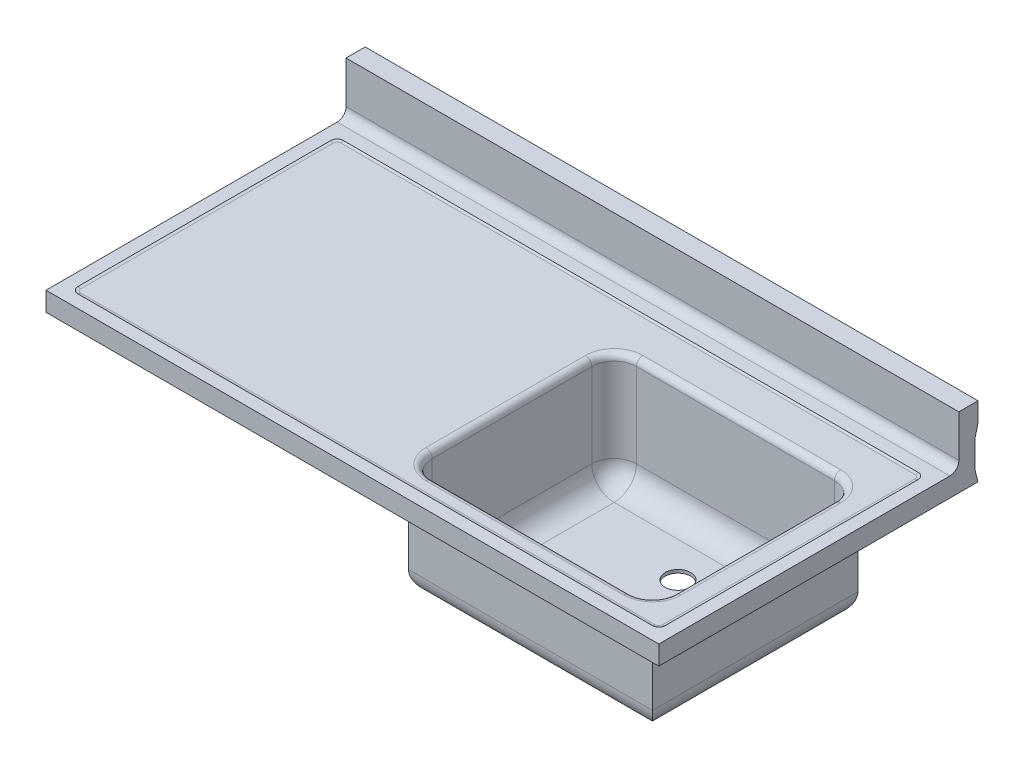
from build123d import *

# Parameters (mm, degrees)
SKETCH1_W           = 1219.2
SKETCH1_H           = 635
BOSS_EXTRUDE2_DEPTH = 330.2
SKETCH3_W           = 1219.2
SKETCH3_H           = 101.6
CUT_EXTRUDE1_DEPTH  = 596.9
FILLET2_R           = 17.78
CUT_EXTRUDE2_DEPTH  = 226.06
FILLET4_R           = 44.45
CUT_EXTRUDE3_DEPTH  = 1.27
FILLET5_R           = 12.7
CUT_EXTRUDE4_DEPTH  = 608.33
CUT_EXTRUDE6_DEPTH  = 316.23
SKETCH12_W          = 635
SKETCH12_H          = 190.5
CUT_EXTRUDE7_DEPTH  = 2.54
SKETCH13_W          = 635
SKETCH13_H          = 190.5
CUT_EXTRUDE8_DEPTH  = 2.54
SKETCH15_R          = 25.4
CUT_EXTRUDE9_DEPTH  = 6.35
CUT_EXTRUDE10_START = -1219.2
CUT_EXTRUDE10_DEPTH = 1219.2


with BuildPart() as part:
    # Sketch1 → Boss-Extrude2 (new body)
    with BuildSketch(Plane(origin=(0, 0, 0), x_dir=(1, 0, 0), z_dir=(0, 1, 0))):
        Rectangle(SKETCH1_W, SKETCH1_H)
    extrude(amount=BOSS_EXTRUDE2_DEPTH)

    # Sketch3 → Cut-Extrude1 (cut)
    with BuildSketch(Plane.XY.offset(317.5)):
        with Locations((0, 279.4)):
            Rectangle(SKETCH3_W, SKETCH3_H)
    extrude(amount=-CUT_EXTRUDE1_DEPTH, mode=Mode.SUBTRACT)

    # Fillet2
    fillet2_edges = [part.edges().sort_by_distance(p)[0] for p in [
        (0, 228.6, -279.4),
    ]]
    fillet(fillet2_edges, radius=FILLET2_R)

    # Sketch5 → Cut-Extrude2 (cut)
    with BuildSketch(Plane(origin=(0, 228.6, 0), x_dir=(1, 0, 0), z_dir=(0, 1, 0))):
        with BuildLine():
            Line((95.25, 152.4), (488.95, 152.4))
            ThreePointArc((488.95, 152.4), (520.380896424, 139.380896424), (533.4, 107.95))
            Line((533.4, 107.95), (533.4, -209.55))
            ThreePointArc((533.4, -209.55), (520.380896424, -240.980896424), (488.95, -254))
            Line((488.95, -254), (95.25, -254))
            ThreePointArc((95.25, -254), (63.819103576, -240.980896424), (50.8, -209.55))
            Line((50.8, -209.55), (50.8, 107.95))
            ThreePointArc((50.8, 107.95), (63.819103576, 139.380896424), (95.25, 152.4))
        make_face()
    extrude(amount=-CUT_EXTRUDE2_DEPTH, mode=Mode.SUBTRACT)

    # Fillet4
    fillet4_edges = [part.edges().sort_by_distance(p)[0] for p in [
        (520.380896424, 2.54, -139.380896424),
        (533.4, 2.54, 50.8),
        (520.380896424, 2.54, 240.980896424),
        (292.1, 2.54, 254),
        (63.819103576, 2.54, 240.980896424),
        (50.8, 2.54, 50.8),
        (63.819103576, 2.54, -139.380896424),
        (292.1, 2.54, -152.4),
    ]]
    fillet(fillet4_edges, radius=FILLET4_R)

    # Sketch7 → Cut-Extrude3 (cut)
    with BuildSketch(Plane(origin=(0, 228.6, 0), x_dir=(1, 0, 0), z_dir=(0, 1, 0))):
        with BuildLine():
            Line((-571.5, -292.1), (571.5, -292.1))
            ThreePointArc((571.5, -292.1), (580.480256121, -288.380256121), (584.2, -279.4))
            Line((584.2, -279.4), (584.2, 223.52))
            ThreePointArc((584.2, 223.52), (580.480256121, 232.500256121), (571.5, 236.22))
            Line((571.5, 236.22), (-571.5, 236.22))
            ThreePointArc((-571.5, 236.22), (-580.480256121, 232.500256121), (-584.2, 223.52))
            Line((-584.2, 223.52), (-584.2, -279.4))
            ThreePointArc((-584.2, -279.4), (-580.480256121, -288.380256121), (-571.5, -292.1))
        make_face()
    extrude(amount=-CUT_EXTRUDE3_DEPTH, mode=Mode.SUBTRACT)

    # Fillet5
    # the kernel refuses this fillet: 12.7 mm, written as the material it adds along each edge
    with BuildSketch(Plane(origin=(-571.5, 227.33, 292.1), x_dir=(0, 0, -1), z_dir=(1, 0, 0)), Plane(origin=(571.5, 227.33, -236.22), x_dir=(0, 0, 1), z_dir=(-1, 0, 0))) as fillet5_piece_1:
        with BuildLine():
            CenterArc((5.535801658, 12.7), FILLET5_R, 244.158067237, 25.841932763)
            Line((0, 1.27), (0, 0))
            Line((0, 0), (5.535801658, 0))
        make_face()
    extrude(amount=1143)
    with BuildSketch(Plane(origin=(-571.5, 227.33, 279.4), x_dir=(-1, 0, 0), z_dir=(0, 0, -1))) as fillet5_piece_2:
        with BuildLine():
            CenterArc((7.164198342, 12.7), FILLET5_R, 270, 25.841932763)
            Line((12.7, 1.27), (12.7, 0))
            Line((12.7, 0), (7.164198342, 0))
        make_face()
    revolve(axis=Axis((-571.5, 227.33, 279.4), (0, 1, 0)), revolution_arc=90)
    with BuildSketch(Plane(origin=(-584.2, 227.33, -223.52), x_dir=(1, 0, 0), z_dir=(0, 0, 1)), Plane(origin=(584.2, 227.33, 279.4), x_dir=(-1, 0, 0), z_dir=(0, 0, -1))) as fillet5_piece_3:
        with BuildLine():
            CenterArc((5.535801658, 12.7), FILLET5_R, 244.158067237, 25.841932763)
            Line((0, 1.27), (0, 0))
            Line((0, 0), (5.535801658, 0))
        make_face()
    extrude(amount=502.92)
    with BuildSketch(Plane(origin=(-571.5, 227.33, -223.52), x_dir=(0, 0, -1), z_dir=(1, 0, 0))) as fillet5_piece_4:
        with BuildLine():
            CenterArc((7.164198342, 12.7), FILLET5_R, 270, 25.841932763)
            Line((12.7, 1.27), (12.7, 0))
            Line((12.7, 0), (7.164198342, 0))
        make_face()
    revolve(axis=Axis((-571.5, 227.33, -223.52), (0, 1, 0)), revolution_arc=90)
    with BuildSketch(Plane(origin=(571.5, 227.33, -223.52), x_dir=(1, 0, 0), z_dir=(0, 0, 1))) as fillet5_piece_5:
        with BuildLine():
            CenterArc((7.164198342, 12.7), FILLET5_R, 270, 25.841932763)
            Line((12.7, 1.27), (12.7, 0))
            Line((12.7, 0), (7.164198342, 0))
        make_face()
    revolve(axis=Axis((571.5, 227.33, -223.52), (0, 1, 0)), revolution_arc=90)
    with BuildSketch(Plane(origin=(571.5, 227.33, 279.4), x_dir=(0, 0, 1), z_dir=(-1, 0, 0))) as fillet5_piece_6:
        with BuildLine():
            CenterArc((7.164198342, 12.7), FILLET5_R, 270, 25.841932763)
            Line((12.7, 1.27), (12.7, 0))
            Line((12.7, 0), (7.164198342, 0))
        make_face()
    revolve(axis=Axis((571.5, 227.33, 279.4), (0, 1, 0)), revolution_arc=90)
    # the kernel refuses this fillet: 12.7 mm, written as the material it takes off along each edge
    with BuildSketch(Plane(origin=(488.95, 227.33, -107.95), x_dir=(1, 0, 0), z_dir=(0, 0, 1))) as fillet5_2_piece_1:
        with BuildLine():
            CenterArc((44.45 + FILLET5_R, -FILLET5_R), FILLET5_R, 90, 90)
            Line((44.45, -FILLET5_R), (44.45, 0))
            Line((44.45, 0), (44.45 + FILLET5_R, 0))
        make_face()
    revolve(axis=Axis((488.95, 227.33, -107.95), (0, 1, 0)), revolution_arc=90, mode=Mode.SUBTRACT)
    with BuildSketch(Plane(origin=(488.95, 227.33, -152.4), x_dir=(0, 0, -1), z_dir=(-1, 0, 0)), Plane(origin=(95.25, 227.33, 254), x_dir=(0, 0, 1), z_dir=(1, 0, 0))) as fillet5_2_piece_2:
        with BuildLine():
            CenterArc((FILLET5_R, FILLET5_R), FILLET5_R, 180, 90)
            Line((0, FILLET5_R), (0, 0))
            Line((0, 0), (FILLET5_R, 0))
        make_face()
    extrude(amount=393.7, mode=Mode.SUBTRACT)
    with BuildSketch(Plane(origin=(95.25, 227.33, -107.95), x_dir=(0, 0, -1), z_dir=(1, 0, 0))) as fillet5_2_piece_3:
        with BuildLine():
            CenterArc((44.45 + FILLET5_R, -FILLET5_R), FILLET5_R, 90, 90)
            Line((44.45, -FILLET5_R), (44.45, 0))
            Line((44.45, 0), (44.45 + FILLET5_R, 0))
        make_face()
    revolve(axis=Axis((95.25, 227.33, -107.95), (0, 1, 0)), revolution_arc=90, mode=Mode.SUBTRACT)
    with BuildSketch(Plane(origin=(50.8, 227.33, -107.95), x_dir=(0, -1, 0), z_dir=(0, 0, 1))) as fillet5_2_piece_4:
        with BuildLine():
            CenterArc((FILLET5_R, -FILLET5_R), FILLET5_R, 90, 90)
            Line((0, -FILLET5_R), (0, 0))
            Line((0, 0), (FILLET5_R, 0))
        make_face()
    extrude(amount=317.5, mode=Mode.SUBTRACT)
    with BuildSketch(Plane(origin=(95.25, 227.33, 209.55), x_dir=(-1, 0, 0), z_dir=(0, 0, -1))) as fillet5_2_piece_5:
        with BuildLine():
            CenterArc((44.45 + FILLET5_R, -FILLET5_R), FILLET5_R, 90, 90)
            Line((44.45, -FILLET5_R), (44.45, 0))
            Line((44.45, 0), (44.45 + FILLET5_R, 0))
        make_face()
    revolve(axis=Axis((95.25, 227.33, 209.55), (0, 1, 0)), revolution_arc=90, mode=Mode.SUBTRACT)
    with BuildSketch(Plane(origin=(488.95, 227.33, 209.55), x_dir=(0, 0, 1), z_dir=(-1, 0, 0))) as fillet5_2_piece_6:
        with BuildLine():
            CenterArc((44.45 + FILLET5_R, -FILLET5_R), FILLET5_R, 90, 90)
            Line((44.45, -FILLET5_R), (44.45, 0))
            Line((44.45, 0), (44.45 + FILLET5_R, 0))
        make_face()
    revolve(axis=Axis((488.95, 227.33, 209.55), (0, 1, 0)), revolution_arc=90, mode=Mode.SUBTRACT)
    with BuildSketch(Plane(origin=(533.4, 227.33, 209.55), x_dir=(1, 0, 0), z_dir=(0, 0, -1))) as fillet5_2_piece_7:
        with BuildLine():
            CenterArc((FILLET5_R, FILLET5_R), FILLET5_R, 180, 90)
            Line((0, FILLET5_R), (0, 0))
            Line((0, 0), (FILLET5_R, 0))
        make_face()
    extrude(amount=317.5, mode=Mode.SUBTRACT)

    # Sketch9 → Cut-Extrude4 (cut, symmetric)
    with BuildSketch(Plane(origin=(0, 0, 0), x_dir=(0, 0, -1), z_dir=(1, 0, 0))):
        with BuildLine():
            Line((317.5, 226.06), (198.12, 226.06))
            ThreePointArc((198.12, 226.06), (166.689103576, 213.040896424), (153.67, 181.61))
            Line((153.67, 181.61), (153.67, 45.72))
            ThreePointArc((153.67, 45.72), (140.650896424, 14.289103576), (109.22, 1.27))
            Line((109.22, 1.27), (-210.82, 1.27))
            ThreePointArc((-210.82, 1.27), (-242.250896424, 14.289103576), (-255.27, 45.72))
            Line((-255.27, 45.72), (-255.27, 181.61))
            ThreePointArc((-255.27, 181.61), (-268.289103576, 213.040896424), (-299.72, 226.06))
            Line((-299.72, 226.06), (-316.23, 226.06))
            Line((-316.23, 226.06), (-316.23, 190.5))
            Line((-316.23, 190.5), (-317.5, 190.5))
            Line((-317.5, 190.5), (-317.5, 0))
            Line((-317.5, 0), (317.5, 0))
            Line((317.5, 0), (317.5, 226.06))
        make_face()
    extrude(amount=CUT_EXTRUDE4_DEPTH, both=True, mode=Mode.SUBTRACT)

    # Sketch11 → Cut-Extrude6 (cut, symmetric)
    with BuildSketch(Plane.XY):
        with BuildLine():
            Line((-608.33, 226.06), (5.08, 226.06))
            ThreePointArc((5.08, 226.06), (36.510896424, 213.040896424), (49.53, 181.61))
            Line((49.53, 181.61), (49.53, 45.72))
            ThreePointArc((49.53, 45.72), (62.549103576, 14.289103576), (93.98, 1.27))
            Line((93.98, 1.27), (-608.33, 1.27))
            Line((-608.33, 1.27), (-608.33, 226.06))
        make_face()
        with BuildLine():
            Line((534.67, 45.72), (534.67, 181.61))
            ThreePointArc((534.67, 181.61), (547.689103576, 213.040896424), (579.12, 226.06))
            Line((579.12, 226.06), (608.33, 226.06))
            Line((608.33, 226.06), (608.33, 1.27))
            Line((608.33, 1.27), (490.22, 1.27))
            ThreePointArc((490.22, 1.27), (521.650896424, 14.289103576), (534.67, 45.72))
        make_face()
    extrude(amount=CUT_EXTRUDE6_DEPTH, both=True, mode=Mode.SUBTRACT)

    # Sketch12 → Cut-Extrude7 (cut)
    with BuildSketch(Plane.ZY.offset(609.6)):
        with Locations((0, 95.25)):
            Rectangle(SKETCH12_W, SKETCH12_H)
    extrude(amount=-CUT_EXTRUDE7_DEPTH, mode=Mode.SUBTRACT)

    # Sketch13 → Cut-Extrude8 (cut)
    with BuildSketch(Plane(origin=(609.6, 0, 0), x_dir=(0, 0, -1), z_dir=(1, 0, 0))):
        with Locations((0, 95.25)):
            Rectangle(SKETCH13_W, SKETCH13_H)
    extrude(amount=-CUT_EXTRUDE8_DEPTH, mode=Mode.SUBTRACT)

    # Sketch16 → Revolve1 (revolve)
    with BuildSketch(Plane(origin=(292.1, 0, 0), x_dir=(0, 0, -1), z_dir=(1, 0, 0)), mode=Mode.PRIVATE) as revolve1_sk:
        with BuildLine():
            Line((38.1, 1.27), (38.1, -3.81))
            Line((38.1, -3.81), (77.47, -3.81))
            ThreePointArc((77.47, -3.81), (86.098103461, -0.38238846), (95.25, 1.178213968))
            Line((95.25, 1.178213968), (95.25, 1.27))
            Line((95.25, 1.27), (38.1, 1.27))
        make_face()
    revolve(revolve1_sk.sketch.rotate(Axis((292.1, 1.27, -38.1), (0, -1, 0)), 180), axis=Axis((292.1, 1.27, -38.1), (0, -1, 0)))

    # Sketch15 → Cut-Extrude9 (cut)
    with BuildSketch(Plane(origin=(0, 2.54, 0), x_dir=(1, 0, 0), z_dir=(0, 1, 0))):
        with Locations(Location((292.1, 38.1, 0), (0, 0, 270))):
            Circle(SKETCH15_R)
    extrude(amount=-CUT_EXTRUDE9_DEPTH, mode=Mode.SUBTRACT)

    # Sketch17 → Cut-Extrude10 (cut)
    with BuildSketch(Plane(origin=(609.6, 0, 0), x_dir=(0, 0, -1), z_dir=(1, 0, 0)).offset(CUT_EXTRUDE10_START)):
        Polygon((317.5, 292.1), (311.15, 266.7), (311.15, 215.9), (317.5, 190.5), align=None)
    extrude(amount=CUT_EXTRUDE10_DEPTH, mode=Mode.SUBTRACT)


solid = part.part
